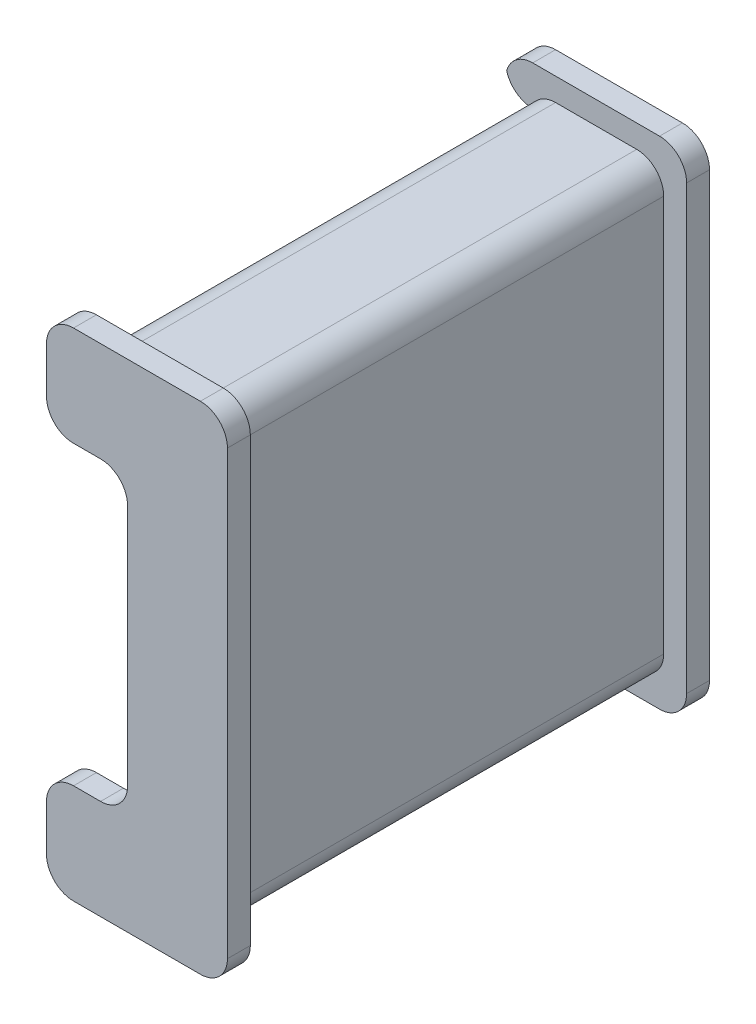
from build123d import *

# Parameters (mm, degrees)
BOSS_EXTRUDE1_DEPTH = 48.42
BOSS_EXTRUDE2_DEPTH = 2.54
BOSS_EXTRUDE3_DEPTH = 2.54
FILLET4_R           = 3
FILLET5_R           = 3


with BuildPart() as part:
    # Sketch1 → Boss-Extrude1 (new body)
    with BuildSketch(Plane.XY):
        Polygon((0, 6), (0, 0), (15, 0), (15, 46.604118993), (15, 50), (0, 50), (0, 44), (9, 44), (9, 6), align=None)
    extrude(amount=BOSS_EXTRUDE1_DEPTH)

    # Sketch2 → Boss-Extrude2 (add)
    with BuildSketch(Plane.XY.offset(48.42)):
        Polygon((-2.54, 41.46), (6.46, 41.46), (6.46, 8.54), (-2.54, 8.54), (-2.54, -2.54), (17.54, -2.54), (17.54, 52.54), (-2.54, 52.54), align=None)
    extrude(amount=BOSS_EXTRUDE2_DEPTH)

    # Sketch3 → Boss-Extrude3 (add)
    with BuildSketch(Plane(origin=(0, 0, 0), x_dir=(-1, 0, 0), z_dir=(0, 0, -1))):
        Polygon((2.54, 52.54), (-17.54, 52.54), (-17.54, 48.156890446), (-17.54, -2.54), (-6.46, -2.54), (2.54, -2.54), (2.54, 8.54), (-6.46, 8.54), (-6.46, 48.156890446), (2.54, 48.156890446), align=None)
    extrude(amount=BOSS_EXTRUDE3_DEPTH)

    # Fillet4
    # the kernel refuses this fillet: 3 mm, written as the material it adds along each edge
    with BuildSketch(Plane(origin=(9, 6, -7.5), x_dir=(0, 1, 0), z_dir=(0, 0, 1))) as fillet4_piece_1_section:
        with BuildLine():
            CenterArc((FILLET4_R, FILLET4_R), FILLET4_R, 180, 90)
            Line((0, FILLET4_R), (0, 0))
            Line((0, 0), (FILLET4_R, 0))
        make_face()
    fillet4_piece_1 = extrude(amount=63.42, mode=Mode.PRIVATE)
    fillet4_piece_1 = split(fillet4_piece_1, bisect_by=Plane(origin=(8.329896183, 6.670103817, 50.96), z_dir=(0, 0, -1)), keep=Keep.TOP, mode=Mode.PRIVATE)
    fillet4_piece_1 = split(fillet4_piece_1, bisect_by=Plane(origin=(8.329896183, 6.670103817, -2.54), z_dir=(0, 0, 1)), keep=Keep.TOP, mode=Mode.PRIVATE)
    add(fillet4_piece_1)
    with BuildSketch(Plane(origin=(9, 44, 0), x_dir=(-1, 0, 0), z_dir=(0, 0, 1))) as fillet4_piece_2_section:
        with BuildLine():
            CenterArc((FILLET4_R, FILLET4_R), FILLET4_R, 180, 90)
            Line((0, FILLET4_R), (0, 0))
            Line((0, 0), (FILLET4_R, 0))
        make_face()
    fillet4_piece_2 = extrude(amount=55.92, mode=Mode.PRIVATE)
    fillet4_piece_2 = split(fillet4_piece_2, bisect_by=Plane(origin=(6.34513643, 43.989367947, 50.96), z_dir=(0, 0, -1)), keep=Keep.TOP, mode=Mode.PRIVATE)
    add(fillet4_piece_2)
    # the kernel refuses this fillet: 3 mm, written as the material it takes off along each edge
    with BuildSketch(Plane(origin=(0, 6, 0), x_dir=(0, -1, 0), z_dir=(0, 0, 1)), Plane(origin=(15, 0, 0), x_dir=(0, 1, 0), z_dir=(0, 0, 1)), Plane(origin=(0, 0, 0), x_dir=(1, 0, 0), z_dir=(0, 0, 1)), Plane(origin=(0, 50, 0), x_dir=(0, -1, 0), z_dir=(0, 0, 1))) as fillet4_2_piece_1:
        with BuildLine():
            CenterArc((FILLET4_R, FILLET4_R), FILLET4_R, 180, 90)
            Line((0, FILLET4_R), (0, 0))
            Line((0, 0), (FILLET4_R, 0))
        make_face()
    extrude(amount=48.42, mode=Mode.SUBTRACT)
    with BuildSketch(Plane(origin=(15, 50, 0), x_dir=(0, -1, 0), z_dir=(0, 0, 1))) as fillet4_2_piece_2:
        with BuildLine():
            CenterArc((FILLET4_R, -FILLET4_R), FILLET4_R, 90, 90)
            Line((0, -FILLET4_R), (0, 0))
            Line((0, 0), (FILLET4_R, 0))
        make_face()
    extrude(amount=48.42, mode=Mode.SUBTRACT)
    with BuildSketch(Plane(origin=(0, 44, -7.5), x_dir=(1, 0, 0), z_dir=(0, 0, 1))) as fillet4_2_piece_3:
        with BuildLine():
            CenterArc((FILLET4_R, FILLET4_R), FILLET4_R, 180, 90)
            Line((0, FILLET4_R), (0, 0))
            Line((0, 0), (FILLET4_R, 0))
        make_face()
    extrude(amount=55.92, mode=Mode.SUBTRACT)

    # Fillet5
    # the kernel refuses this fillet: 3 mm, written as the material it adds along each edge
    with BuildSketch(Plane(origin=(6.46, 41.46, 48.42), x_dir=(0, -1, 0), z_dir=(0, 0, 1)), Plane(origin=(6.46, 8.54, 48.42), x_dir=(-1, 0, 0), z_dir=(0, 0, 1)), Plane(origin=(6.46, 8.54, 0), x_dir=(0, 1, 0), z_dir=(0, 0, -1))) as fillet5_piece_1:
        with BuildLine():
            CenterArc((FILLET5_R, -FILLET5_R), FILLET5_R, 90, 90)
            Line((0, -FILLET5_R), (0, 0))
            Line((0, 0), (FILLET5_R, 0))
        make_face()
    extrude(amount=2.54)
    with BuildSketch(Plane(origin=(6.46, 48.156890446, 7.5), x_dir=(0, -1, 0), z_dir=(0, 0, -1))) as fillet5_piece_2:
        with BuildLine():
            CenterArc((FILLET5_R, FILLET5_R), FILLET5_R, 180, 90)
            Line((0, FILLET5_R), (0, 0))
            Line((0, 0), (FILLET5_R, 0))
        make_face()
    extrude(amount=10.04)
    # the kernel refuses this fillet: 3 mm, written as the material it takes off along each edge
    with BuildSketch(Plane(origin=(-2.54, 52.54, 40.92), x_dir=(1, 0, 0), z_dir=(0, 0, 1)), Plane(origin=(-2.54, 8.54, 40.92), x_dir=(1, 0, 0), z_dir=(0, 0, 1)), Plane(origin=(-2.54, -2.54, 40.92), x_dir=(0, 1, 0), z_dir=(0, 0, 1)), Plane(origin=(17.54, -2.54, 40.92), x_dir=(-1, 0, 0), z_dir=(0, 0, 1)), Plane(origin=(17.54, 52.54, 40.92), x_dir=(0, -1, 0), z_dir=(0, 0, 1)), Plane(origin=(-2.54, 52.54, 7.5), x_dir=(0, -1, 0), z_dir=(0, 0, -1)), Plane(origin=(17.54, 52.54, 7.5), x_dir=(-1, 0, 0), z_dir=(0, 0, -1)), Plane(origin=(17.54, -2.54, 7.5), x_dir=(0, 1, 0), z_dir=(0, 0, -1)), Plane(origin=(-2.54, -2.54, 7.5), x_dir=(1, 0, 0), z_dir=(0, 0, -1)), Plane(origin=(-2.54, 8.54, 7.5), x_dir=(0, -1, 0), z_dir=(0, 0, -1))) as fillet5_2_piece_1:
        with BuildLine():
            CenterArc((FILLET5_R, -FILLET5_R), FILLET5_R, 90, 90)
            Line((0, -FILLET5_R), (0, 0))
            Line((0, 0), (FILLET5_R, 0))
        make_face()
    extrude(amount=17.54, mode=Mode.SUBTRACT)
    with BuildSketch(Plane(origin=(-2.54, 41.46, 40.92), x_dir=(1, 0, 0), z_dir=(0, 0, 1))) as fillet5_2_piece_2:
        with BuildLine():
            CenterArc((FILLET5_R, FILLET5_R), FILLET5_R, 180, 90)
            Line((0, FILLET5_R), (0, 0))
            Line((0, 0), (FILLET5_R, 0))
        make_face()
    extrude(amount=17.54, mode=Mode.SUBTRACT)
    with BuildSketch(Plane(origin=(-2.54, 48.156890446, 0), x_dir=(1, 0, 0), z_dir=(0, 0, -1))) as fillet5_2_piece_3:
        with BuildLine():
            CenterArc((FILLET5_R, -FILLET5_R), FILLET5_R, 90, 90)
            Line((0, -FILLET5_R), (0, 0))
            Line((0, 0), (FILLET5_R, 0))
        make_face()
    extrude(amount=10.04, mode=Mode.SUBTRACT)


solid = part.part
